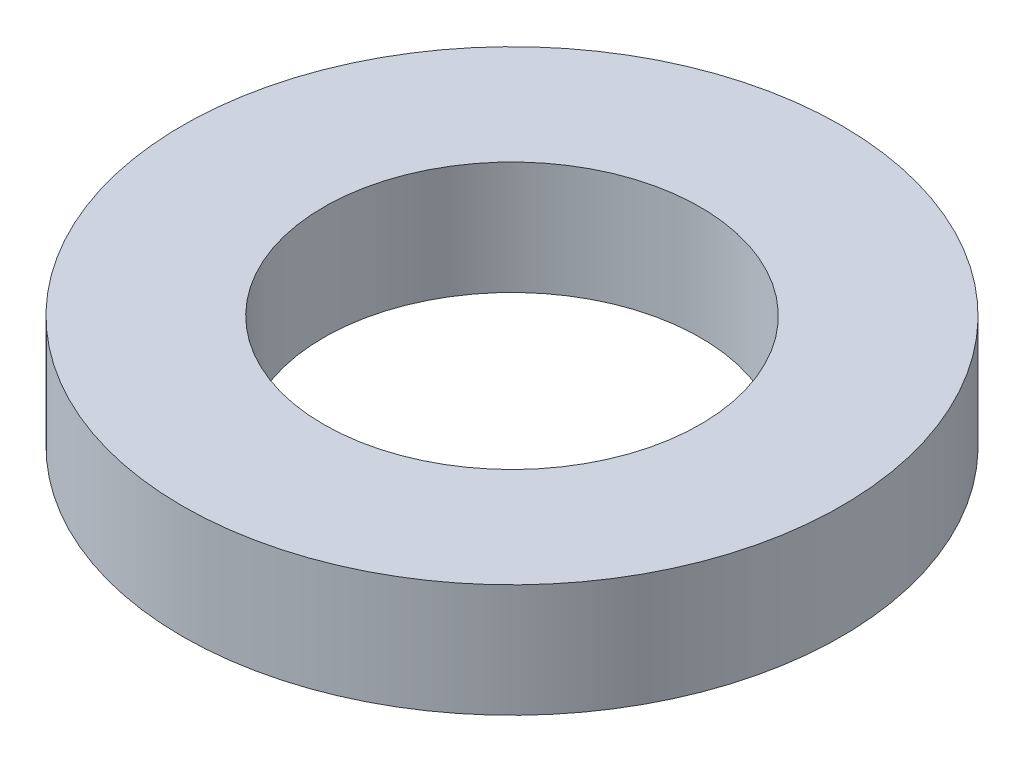
from build123d import *

# Parameters (mm, degrees)
SKETCH1_R           = 87.5
BOSS_EXTRUDE1_DEPTH = 30
SKETCH2_R           = 50
CUT_EXTRUDE1_DEPTH  = 128.328315782


with BuildPart() as part:
    # Sketch1 → Boss-Extrude1 (new body)
    with BuildSketch(Plane(origin=(0, 0, 0), x_dir=(1, 0, 0), z_dir=(0, 1, 0))):
        Circle(SKETCH1_R)
    extrude(amount=BOSS_EXTRUDE1_DEPTH)

    # Sketch2 → Cut-Extrude1 (cut, through all)
    with BuildSketch(Plane(origin=(0, 0, 0), x_dir=(1, 0, 0), z_dir=(0, 1, 0))):
        Circle(SKETCH2_R)
    extrude(amount=CUT_EXTRUDE1_DEPTH, mode=Mode.SUBTRACT)


solid = part.part
